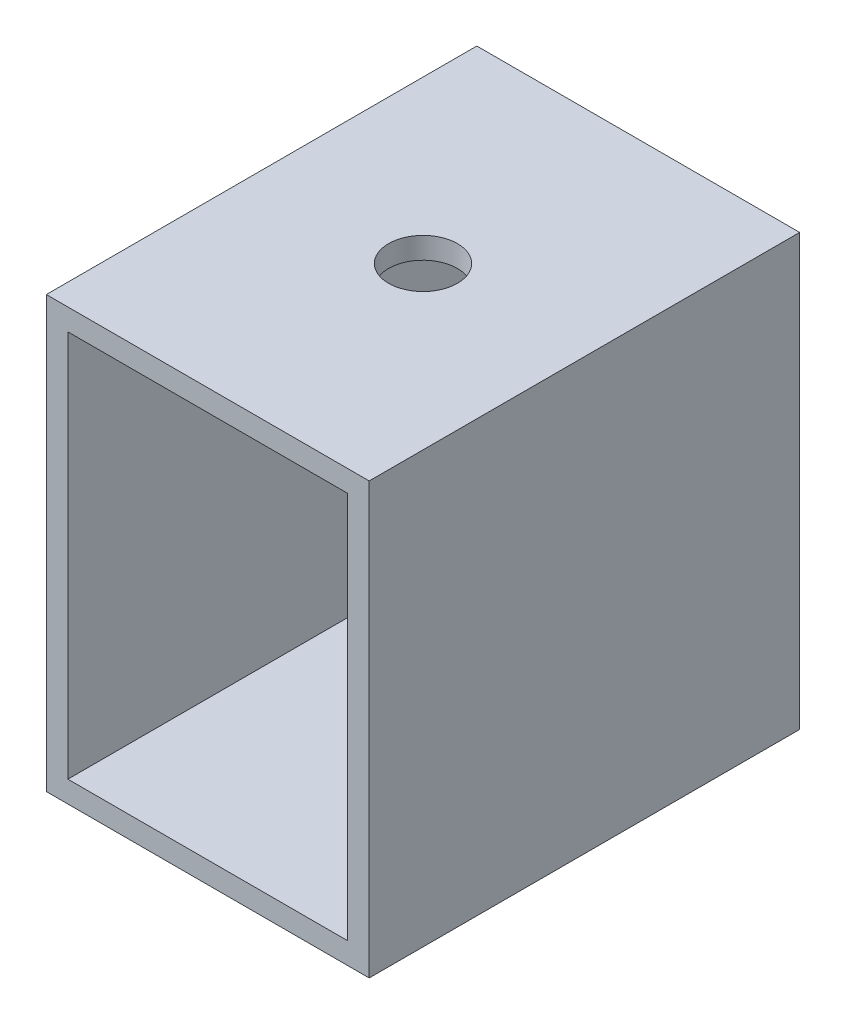
from build123d import *

# Parameters (mm, degrees)
SKETCH_1_W          = 15
SKETCH_1_H          = 20
SKETCH_1_W_2        = 13
SKETCH_1_H_2        = 18
EXTRUDE_1_DEPTH     = 20
SKETCH_3_R          = 1.6
CUT_EXTRUDE_2_DEPTH = 33.015621187


with BuildPart() as part:
    # 草图1 → 拉伸-薄壁1 (new body)
    with BuildSketch(Plane.XY):
        with Locations((7.5, -10)):
            Rectangle(SKETCH_1_W, SKETCH_1_H)
        with Locations((7.5, -10)):
            Rectangle(SKETCH_1_W_2, SKETCH_1_H_2, mode=Mode.SUBTRACT)
    extrude(amount=EXTRUDE_1_DEPTH)

    # 草图3 → 切除-拉伸2 (cut, through all)
    with BuildSketch(Plane.XZ.offset(20)):
        with Locations((7.5, 10)):
            Circle(SKETCH_3_R)
    extrude(amount=-CUT_EXTRUDE_2_DEPTH, mode=Mode.SUBTRACT)


solid = part.part
